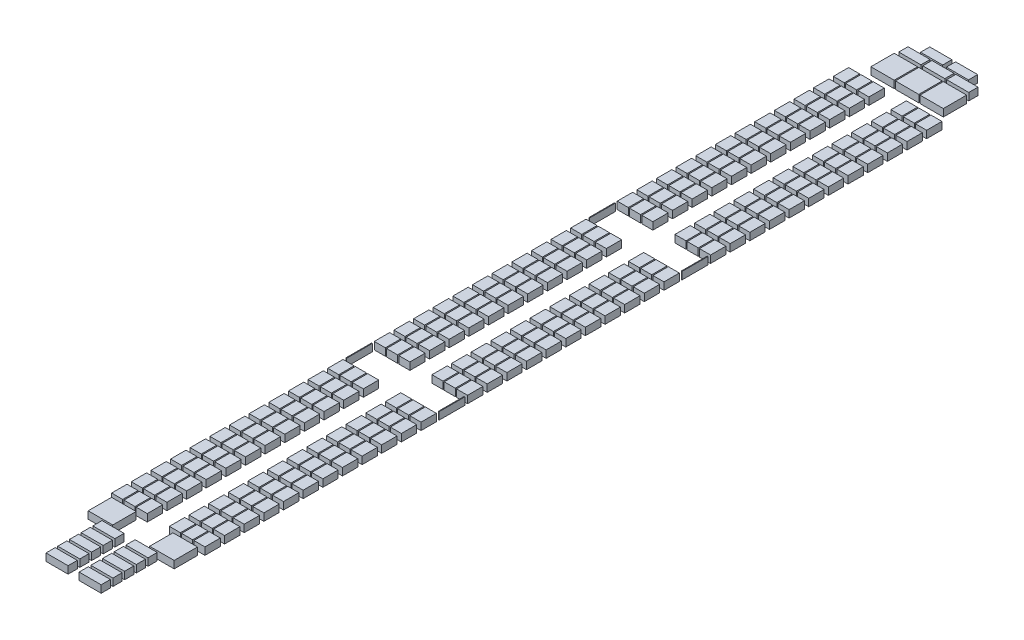
from build123d import *

# Parameters (mm, degrees)
SEATING_LAYOUT_W  = 457.2
SEATING_LAYOUT_H  = 635
SEATINGS_DEPTH    = 304.8
EMERGENCY_DOORS_W = 30.48
EMERGENCY_DOORS_H = 1066.8
EM_DOORS_DEPTH    = 304.8
EM_DOORS_2_DEPTH  = 304.8
EM_DOORS_3_DEPTH  = 304.8
EM_DOORS_4_DEPTH  = 304.8
LAVATORIES_W      = 1016
LAVATORIES_H      = 965.2
LAV_DEPTH         = 304.8
LAV_2_DEPTH       = 304.8
LAVATORIES_W_2    = 965.2
LAV_3_DEPTH       = 304.8
LAV_4_DEPTH       = 304.8
LAV_5_DEPTH       = 304.8
GALLEY_CARTS_W    = 914.4
GALLEY_CARTS_H    = 381
GALLEY_DEPTH      = 304.8
GALLEY_2_DEPTH    = 304.8
GALLEY_3_DEPTH    = 304.8
GALLEY_4_DEPTH    = 304.8
GALLEY_5_DEPTH    = 304.8
GALLEY_6_DEPTH    = 304.8
GALLEY_7_DEPTH    = 304.8
GALLEY_8_DEPTH    = 304.8
GALLEY_9_DEPTH    = 304.8
GALLEY_10_DEPTH   = 304.8
GALLEY_11_DEPTH   = 304.8
GALLEY_12_DEPTH   = 304.8
GALLEY_13_DEPTH   = 304.8
GALLEY_14_DEPTH   = 304.8
GALLEY_15_DEPTH   = 304.8


with BuildPart() as part:
    # Seating layout → Seatings (new body)
    with BuildSketch(Plane(origin=(0, 0, 0), x_dir=(1, 0, 0), z_dir=(0, 1, 0))):
        with Locations((-1193.292, -14930.966666667)):
            Rectangle(SEATING_LAYOUT_W, SEATING_LAYOUT_H)
        with Locations((-1701.292, -14930.966666667)):
            Rectangle(SEATING_LAYOUT_W, SEATING_LAYOUT_H)
        with Locations((-685.292, -14930.966666667)):
            Rectangle(SEATING_LAYOUT_W, SEATING_LAYOUT_H)
        with Locations((-1193.292, -14118.166666667)):
            Rectangle(SEATING_LAYOUT_W, SEATING_LAYOUT_H)
        with Locations((-685.292, -14118.166666667)):
            Rectangle(SEATING_LAYOUT_W, SEATING_LAYOUT_H)
        with Locations((-1193.292, -13305.366666667)):
            Rectangle(SEATING_LAYOUT_W, SEATING_LAYOUT_H)
        with Locations((-685.292, -13305.366666667)):
            Rectangle(SEATING_LAYOUT_W, SEATING_LAYOUT_H)
        with Locations((-1701.292, -14118.166666667)):
            Rectangle(SEATING_LAYOUT_W, SEATING_LAYOUT_H)
        with Locations((-1701.292, -13305.366666667)):
            Rectangle(SEATING_LAYOUT_W, SEATING_LAYOUT_H)
        with Locations((-1701.292, -12492.566666667)):
            Rectangle(SEATING_LAYOUT_W, SEATING_LAYOUT_H)
        with Locations((-1193.292, -12492.566666667)):
            Rectangle(SEATING_LAYOUT_W, SEATING_LAYOUT_H)
        with Locations((-685.292, -12492.566666667)):
            Rectangle(SEATING_LAYOUT_W, SEATING_LAYOUT_H)
        with Locations((-1701.292, -11679.766666667)):
            Rectangle(SEATING_LAYOUT_W, SEATING_LAYOUT_H)
        with Locations((-1193.292, -11679.766666667)):
            Rectangle(SEATING_LAYOUT_W, SEATING_LAYOUT_H)
        with Locations((-685.292, -11679.766666667)):
            Rectangle(SEATING_LAYOUT_W, SEATING_LAYOUT_H)
        with Locations((-1701.292, -10866.966666667)):
            Rectangle(SEATING_LAYOUT_W, SEATING_LAYOUT_H)
        with Locations((-1193.292, -10866.966666667)):
            Rectangle(SEATING_LAYOUT_W, SEATING_LAYOUT_H)
        with Locations((-685.292, -10866.966666667)):
            Rectangle(SEATING_LAYOUT_W, SEATING_LAYOUT_H)
        with Locations((-1701.292, -10054.166666667)):
            Rectangle(SEATING_LAYOUT_W, SEATING_LAYOUT_H)
        with Locations((-1193.292, -10054.166666667)):
            Rectangle(SEATING_LAYOUT_W, SEATING_LAYOUT_H)
        with Locations((-685.292, -10054.166666667)):
            Rectangle(SEATING_LAYOUT_W, SEATING_LAYOUT_H)
        with Locations((-1701.292, -9241.366666667)):
            Rectangle(SEATING_LAYOUT_W, SEATING_LAYOUT_H)
        with Locations((-1193.292, -9241.366666667)):
            Rectangle(SEATING_LAYOUT_W, SEATING_LAYOUT_H)
        with Locations((-685.292, -9241.366666667)):
            Rectangle(SEATING_LAYOUT_W, SEATING_LAYOUT_H)
        with Locations((-1701.292, -8428.566666667)):
            Rectangle(SEATING_LAYOUT_W, SEATING_LAYOUT_H)
        with Locations((-1193.292, -8428.566666667)):
            Rectangle(SEATING_LAYOUT_W, SEATING_LAYOUT_H)
        with Locations((-685.292, -8428.566666667)):
            Rectangle(SEATING_LAYOUT_W, SEATING_LAYOUT_H)
        with Locations((-1701.292, -7615.766666667)):
            Rectangle(SEATING_LAYOUT_W, SEATING_LAYOUT_H)
        with Locations((-1193.292, -7615.766666667)):
            Rectangle(SEATING_LAYOUT_W, SEATING_LAYOUT_H)
        with Locations((-685.292, -7615.766666667)):
            Rectangle(SEATING_LAYOUT_W, SEATING_LAYOUT_H)
        with Locations((-1701.292, -6802.966666667)):
            Rectangle(SEATING_LAYOUT_W, SEATING_LAYOUT_H)
        with Locations((-1193.292, -6802.966666667)):
            Rectangle(SEATING_LAYOUT_W, SEATING_LAYOUT_H)
        with Locations((-685.292, -6802.966666667)):
            Rectangle(SEATING_LAYOUT_W, SEATING_LAYOUT_H)
        with Locations((-1701.292, -5990.166666667)):
            Rectangle(SEATING_LAYOUT_W, SEATING_LAYOUT_H)
        with Locations((-1193.292, -5990.166666667)):
            Rectangle(SEATING_LAYOUT_W, SEATING_LAYOUT_H)
        with Locations((-685.292, -5990.166666667)):
            Rectangle(SEATING_LAYOUT_W, SEATING_LAYOUT_H)
        with Locations((-1701.292, -4064)):
            Rectangle(SEATING_LAYOUT_W, SEATING_LAYOUT_H)
        with Locations((-1193.292, -4064)):
            Rectangle(SEATING_LAYOUT_W, SEATING_LAYOUT_H)
        with Locations((-685.292, -4064)):
            Rectangle(SEATING_LAYOUT_W, SEATING_LAYOUT_H)
        with Locations((-1193.292, -3251.2)):
            Rectangle(SEATING_LAYOUT_W, SEATING_LAYOUT_H)
        with Locations((-685.292, -3251.2)):
            Rectangle(SEATING_LAYOUT_W, SEATING_LAYOUT_H)
        with Locations((-1193.292, -2438.4)):
            Rectangle(SEATING_LAYOUT_W, SEATING_LAYOUT_H)
        with Locations((-685.292, -2438.4)):
            Rectangle(SEATING_LAYOUT_W, SEATING_LAYOUT_H)
        with Locations((-1193.292, -1625.6)):
            Rectangle(SEATING_LAYOUT_W, SEATING_LAYOUT_H)
        with Locations((-685.292, -1625.6)):
            Rectangle(SEATING_LAYOUT_W, SEATING_LAYOUT_H)
        with Locations((-1193.292, -812.8)):
            Rectangle(SEATING_LAYOUT_W, SEATING_LAYOUT_H)
        with Locations((-685.292, -812.8)):
            Rectangle(SEATING_LAYOUT_W, SEATING_LAYOUT_H)
        with Locations((-1701.292, -3251.2)):
            Rectangle(SEATING_LAYOUT_W, SEATING_LAYOUT_H)
        with Locations((-1701.292, -2438.4)):
            Rectangle(SEATING_LAYOUT_W, SEATING_LAYOUT_H)
        with Locations((-1701.292, -1625.6)):
            Rectangle(SEATING_LAYOUT_W, SEATING_LAYOUT_H)
        with Locations((-1701.292, -812.8)):
            Rectangle(SEATING_LAYOUT_W, SEATING_LAYOUT_H)
        with Locations((-1701.292, 0)):
            Rectangle(SEATING_LAYOUT_W, SEATING_LAYOUT_H)
        with Locations((-1193.292, 0)):
            Rectangle(SEATING_LAYOUT_W, SEATING_LAYOUT_H)
        with Locations((-685.292, 0)):
            Rectangle(SEATING_LAYOUT_W, SEATING_LAYOUT_H)
        with Locations((-1701.292, 812.8)):
            Rectangle(SEATING_LAYOUT_W, SEATING_LAYOUT_H)
        with Locations((-1193.292, 812.8)):
            Rectangle(SEATING_LAYOUT_W, SEATING_LAYOUT_H)
        with Locations((-685.292, 812.8)):
            Rectangle(SEATING_LAYOUT_W, SEATING_LAYOUT_H)
        with Locations((-1701.292, 1625.6)):
            Rectangle(SEATING_LAYOUT_W, SEATING_LAYOUT_H)
        with Locations((-1193.292, 1625.6)):
            Rectangle(SEATING_LAYOUT_W, SEATING_LAYOUT_H)
        with Locations((-685.292, 1625.6)):
            Rectangle(SEATING_LAYOUT_W, SEATING_LAYOUT_H)
        with Locations((-1701.292, 2438.4)):
            Rectangle(SEATING_LAYOUT_W, SEATING_LAYOUT_H)
        with Locations((-1193.292, 2438.4)):
            Rectangle(SEATING_LAYOUT_W, SEATING_LAYOUT_H)
        with Locations((-685.292, 2438.4)):
            Rectangle(SEATING_LAYOUT_W, SEATING_LAYOUT_H)
        with Locations((-1701.292, 3251.2)):
            Rectangle(SEATING_LAYOUT_W, SEATING_LAYOUT_H)
        with Locations((-1193.292, 3251.2)):
            Rectangle(SEATING_LAYOUT_W, SEATING_LAYOUT_H)
        with Locations((-685.292, 3251.2)):
            Rectangle(SEATING_LAYOUT_W, SEATING_LAYOUT_H)
        with Locations((-1701.292, 4064)):
            Rectangle(SEATING_LAYOUT_W, SEATING_LAYOUT_H)
        with Locations((-1193.292, 4064)):
            Rectangle(SEATING_LAYOUT_W, SEATING_LAYOUT_H)
        with Locations((-685.292, 4064)):
            Rectangle(SEATING_LAYOUT_W, SEATING_LAYOUT_H)
        with Locations((-685.292, 14930.966666667)):
            Rectangle(SEATING_LAYOUT_W, SEATING_LAYOUT_H)
        with Locations((-1193.292, 14930.966666667)):
            Rectangle(SEATING_LAYOUT_W, SEATING_LAYOUT_H)
        with Locations((-1701.292, 14930.966666667)):
            Rectangle(SEATING_LAYOUT_W, SEATING_LAYOUT_H)
        with Locations((-685.292, 5990.166666667)):
            Rectangle(SEATING_LAYOUT_W, SEATING_LAYOUT_H)
        with Locations((-1193.292, 5990.166666667)):
            Rectangle(SEATING_LAYOUT_W, SEATING_LAYOUT_H)
        with Locations((-1701.292, 5990.166666667)):
            Rectangle(SEATING_LAYOUT_W, SEATING_LAYOUT_H)
        with Locations((-685.292, 6802.966666667)):
            Rectangle(SEATING_LAYOUT_W, SEATING_LAYOUT_H)
        with Locations((-1193.292, 6802.966666667)):
            Rectangle(SEATING_LAYOUT_W, SEATING_LAYOUT_H)
        with Locations((-1701.292, 6802.966666667)):
            Rectangle(SEATING_LAYOUT_W, SEATING_LAYOUT_H)
        with Locations((-685.292, 7615.766666667)):
            Rectangle(SEATING_LAYOUT_W, SEATING_LAYOUT_H)
        with Locations((-1193.292, 7615.766666667)):
            Rectangle(SEATING_LAYOUT_W, SEATING_LAYOUT_H)
        with Locations((-1701.292, 7615.766666667)):
            Rectangle(SEATING_LAYOUT_W, SEATING_LAYOUT_H)
        with Locations((-685.292, 8428.566666667)):
            Rectangle(SEATING_LAYOUT_W, SEATING_LAYOUT_H)
        with Locations((-1193.292, 8428.566666667)):
            Rectangle(SEATING_LAYOUT_W, SEATING_LAYOUT_H)
        with Locations((-1701.292, 8428.566666667)):
            Rectangle(SEATING_LAYOUT_W, SEATING_LAYOUT_H)
        with Locations((-685.292, 9241.366666667)):
            Rectangle(SEATING_LAYOUT_W, SEATING_LAYOUT_H)
        with Locations((-1193.292, 9241.366666667)):
            Rectangle(SEATING_LAYOUT_W, SEATING_LAYOUT_H)
        with Locations((-1701.292, 9241.366666667)):
            Rectangle(SEATING_LAYOUT_W, SEATING_LAYOUT_H)
        with Locations((-685.292, 10054.166666667)):
            Rectangle(SEATING_LAYOUT_W, SEATING_LAYOUT_H)
        with Locations((-1193.292, 10054.166666667)):
            Rectangle(SEATING_LAYOUT_W, SEATING_LAYOUT_H)
        with Locations((-1701.292, 10054.166666667)):
            Rectangle(SEATING_LAYOUT_W, SEATING_LAYOUT_H)
        with Locations((-685.292, 10866.966666667)):
            Rectangle(SEATING_LAYOUT_W, SEATING_LAYOUT_H)
        with Locations((-1193.292, 10866.966666667)):
            Rectangle(SEATING_LAYOUT_W, SEATING_LAYOUT_H)
        with Locations((-1701.292, 10866.966666667)):
            Rectangle(SEATING_LAYOUT_W, SEATING_LAYOUT_H)
        with Locations((-685.292, 11679.766666667)):
            Rectangle(SEATING_LAYOUT_W, SEATING_LAYOUT_H)
        with Locations((-1193.292, 11679.766666667)):
            Rectangle(SEATING_LAYOUT_W, SEATING_LAYOUT_H)
        with Locations((-1701.292, 11679.766666667)):
            Rectangle(SEATING_LAYOUT_W, SEATING_LAYOUT_H)
        with Locations((-685.292, 12492.566666667)):
            Rectangle(SEATING_LAYOUT_W, SEATING_LAYOUT_H)
        with Locations((-1193.292, 12492.566666667)):
            Rectangle(SEATING_LAYOUT_W, SEATING_LAYOUT_H)
        with Locations((-1701.292, 12492.566666667)):
            Rectangle(SEATING_LAYOUT_W, SEATING_LAYOUT_H)
        with Locations((-1701.292, 13305.366666667)):
            Rectangle(SEATING_LAYOUT_W, SEATING_LAYOUT_H)
        with Locations((-1701.292, 14118.166666667)):
            Rectangle(SEATING_LAYOUT_W, SEATING_LAYOUT_H)
        with Locations((-685.292, 13305.366666667)):
            Rectangle(SEATING_LAYOUT_W, SEATING_LAYOUT_H)
        with Locations((-1193.292, 13305.366666667)):
            Rectangle(SEATING_LAYOUT_W, SEATING_LAYOUT_H)
        with Locations((-685.292, 14118.166666667)):
            Rectangle(SEATING_LAYOUT_W, SEATING_LAYOUT_H)
        with Locations((-1193.292, 14118.166666667)):
            Rectangle(SEATING_LAYOUT_W, SEATING_LAYOUT_H)
        with Locations((1193.292, 14930.966666667)):
            Rectangle(SEATING_LAYOUT_W, SEATING_LAYOUT_H)
        with Locations((1701.292, 14930.966666667)):
            Rectangle(SEATING_LAYOUT_W, SEATING_LAYOUT_H)
        with Locations((685.292, 14930.966666667)):
            Rectangle(SEATING_LAYOUT_W, SEATING_LAYOUT_H)
        with Locations((1193.292, 14118.166666667)):
            Rectangle(SEATING_LAYOUT_W, SEATING_LAYOUT_H)
        with Locations((685.292, 14118.166666667)):
            Rectangle(SEATING_LAYOUT_W, SEATING_LAYOUT_H)
        with Locations((1193.292, 13305.366666667)):
            Rectangle(SEATING_LAYOUT_W, SEATING_LAYOUT_H)
        with Locations((685.292, 13305.366666667)):
            Rectangle(SEATING_LAYOUT_W, SEATING_LAYOUT_H)
        with Locations((1701.292, 14118.166666667)):
            Rectangle(SEATING_LAYOUT_W, SEATING_LAYOUT_H)
        with Locations((1701.292, 13305.366666667)):
            Rectangle(SEATING_LAYOUT_W, SEATING_LAYOUT_H)
        with Locations((1701.292, 12492.566666667)):
            Rectangle(SEATING_LAYOUT_W, SEATING_LAYOUT_H)
        with Locations((1193.292, 12492.566666667)):
            Rectangle(SEATING_LAYOUT_W, SEATING_LAYOUT_H)
        with Locations((685.292, 12492.566666667)):
            Rectangle(SEATING_LAYOUT_W, SEATING_LAYOUT_H)
        with Locations((1701.292, 11679.766666667)):
            Rectangle(SEATING_LAYOUT_W, SEATING_LAYOUT_H)
        with Locations((1193.292, 11679.766666667)):
            Rectangle(SEATING_LAYOUT_W, SEATING_LAYOUT_H)
        with Locations((685.292, 11679.766666667)):
            Rectangle(SEATING_LAYOUT_W, SEATING_LAYOUT_H)
        with Locations((1701.292, 10866.966666667)):
            Rectangle(SEATING_LAYOUT_W, SEATING_LAYOUT_H)
        with Locations((1193.292, 10866.966666667)):
            Rectangle(SEATING_LAYOUT_W, SEATING_LAYOUT_H)
        with Locations((685.292, 10866.966666667)):
            Rectangle(SEATING_LAYOUT_W, SEATING_LAYOUT_H)
        with Locations((1701.292, 10054.166666667)):
            Rectangle(SEATING_LAYOUT_W, SEATING_LAYOUT_H)
        with Locations((1193.292, 10054.166666667)):
            Rectangle(SEATING_LAYOUT_W, SEATING_LAYOUT_H)
        with Locations((685.292, 10054.166666667)):
            Rectangle(SEATING_LAYOUT_W, SEATING_LAYOUT_H)
        with Locations((1701.292, 9241.366666667)):
            Rectangle(SEATING_LAYOUT_W, SEATING_LAYOUT_H)
        with Locations((1193.292, 9241.366666667)):
            Rectangle(SEATING_LAYOUT_W, SEATING_LAYOUT_H)
        with Locations((685.292, 9241.366666667)):
            Rectangle(SEATING_LAYOUT_W, SEATING_LAYOUT_H)
        with Locations((1701.292, 8428.566666667)):
            Rectangle(SEATING_LAYOUT_W, SEATING_LAYOUT_H)
        with Locations((1193.292, 8428.566666667)):
            Rectangle(SEATING_LAYOUT_W, SEATING_LAYOUT_H)
        with Locations((685.292, 8428.566666667)):
            Rectangle(SEATING_LAYOUT_W, SEATING_LAYOUT_H)
        with Locations((1701.292, 7615.766666667)):
            Rectangle(SEATING_LAYOUT_W, SEATING_LAYOUT_H)
        with Locations((1193.292, 7615.766666667)):
            Rectangle(SEATING_LAYOUT_W, SEATING_LAYOUT_H)
        with Locations((685.292, 7615.766666667)):
            Rectangle(SEATING_LAYOUT_W, SEATING_LAYOUT_H)
        with Locations((1701.292, 6802.966666667)):
            Rectangle(SEATING_LAYOUT_W, SEATING_LAYOUT_H)
        with Locations((1193.292, 6802.966666667)):
            Rectangle(SEATING_LAYOUT_W, SEATING_LAYOUT_H)
        with Locations((685.292, 6802.966666667)):
            Rectangle(SEATING_LAYOUT_W, SEATING_LAYOUT_H)
        with Locations((1701.292, 5990.166666667)):
            Rectangle(SEATING_LAYOUT_W, SEATING_LAYOUT_H)
        with Locations((1193.292, 5990.166666667)):
            Rectangle(SEATING_LAYOUT_W, SEATING_LAYOUT_H)
        with Locations((685.292, 5990.166666667)):
            Rectangle(SEATING_LAYOUT_W, SEATING_LAYOUT_H)
        with Locations((685.292, 4064)):
            Rectangle(SEATING_LAYOUT_W, SEATING_LAYOUT_H)
        with Locations((1193.292, 4064)):
            Rectangle(SEATING_LAYOUT_W, SEATING_LAYOUT_H)
        with Locations((1701.292, 4064)):
            Rectangle(SEATING_LAYOUT_W, SEATING_LAYOUT_H)
        with Locations((685.292, 3251.2)):
            Rectangle(SEATING_LAYOUT_W, SEATING_LAYOUT_H)
        with Locations((1193.292, 3251.2)):
            Rectangle(SEATING_LAYOUT_W, SEATING_LAYOUT_H)
        with Locations((1701.292, 3251.2)):
            Rectangle(SEATING_LAYOUT_W, SEATING_LAYOUT_H)
        with Locations((685.292, 2438.4)):
            Rectangle(SEATING_LAYOUT_W, SEATING_LAYOUT_H)
        with Locations((1193.292, 2438.4)):
            Rectangle(SEATING_LAYOUT_W, SEATING_LAYOUT_H)
        with Locations((1701.292, 2438.4)):
            Rectangle(SEATING_LAYOUT_W, SEATING_LAYOUT_H)
        with Locations((685.292, 1625.6)):
            Rectangle(SEATING_LAYOUT_W, SEATING_LAYOUT_H)
        with Locations((1193.292, 1625.6)):
            Rectangle(SEATING_LAYOUT_W, SEATING_LAYOUT_H)
        with Locations((1701.292, 1625.6)):
            Rectangle(SEATING_LAYOUT_W, SEATING_LAYOUT_H)
        with Locations((685.292, 812.8)):
            Rectangle(SEATING_LAYOUT_W, SEATING_LAYOUT_H)
        with Locations((1193.292, 812.8)):
            Rectangle(SEATING_LAYOUT_W, SEATING_LAYOUT_H)
        with Locations((1701.292, 812.8)):
            Rectangle(SEATING_LAYOUT_W, SEATING_LAYOUT_H)
        with Locations((685.292, 0)):
            Rectangle(SEATING_LAYOUT_W, SEATING_LAYOUT_H)
        with Locations((1193.292, 0)):
            Rectangle(SEATING_LAYOUT_W, SEATING_LAYOUT_H)
        with Locations((1701.292, 0)):
            Rectangle(SEATING_LAYOUT_W, SEATING_LAYOUT_H)
        with Locations((1701.292, -812.8)):
            Rectangle(SEATING_LAYOUT_W, SEATING_LAYOUT_H)
        with Locations((1701.292, -1625.6)):
            Rectangle(SEATING_LAYOUT_W, SEATING_LAYOUT_H)
        with Locations((1701.292, -2438.4)):
            Rectangle(SEATING_LAYOUT_W, SEATING_LAYOUT_H)
        with Locations((1701.292, -3251.2)):
            Rectangle(SEATING_LAYOUT_W, SEATING_LAYOUT_H)
        with Locations((685.292, -812.8)):
            Rectangle(SEATING_LAYOUT_W, SEATING_LAYOUT_H)
        with Locations((1193.292, -812.8)):
            Rectangle(SEATING_LAYOUT_W, SEATING_LAYOUT_H)
        with Locations((685.292, -1625.6)):
            Rectangle(SEATING_LAYOUT_W, SEATING_LAYOUT_H)
        with Locations((1193.292, -1625.6)):
            Rectangle(SEATING_LAYOUT_W, SEATING_LAYOUT_H)
        with Locations((685.292, -2438.4)):
            Rectangle(SEATING_LAYOUT_W, SEATING_LAYOUT_H)
        with Locations((1193.292, -2438.4)):
            Rectangle(SEATING_LAYOUT_W, SEATING_LAYOUT_H)
        with Locations((685.292, -3251.2)):
            Rectangle(SEATING_LAYOUT_W, SEATING_LAYOUT_H)
        with Locations((1193.292, -3251.2)):
            Rectangle(SEATING_LAYOUT_W, SEATING_LAYOUT_H)
        with Locations((685.292, -4064)):
            Rectangle(SEATING_LAYOUT_W, SEATING_LAYOUT_H)
        with Locations((1193.292, -4064)):
            Rectangle(SEATING_LAYOUT_W, SEATING_LAYOUT_H)
        with Locations((1701.292, -4064)):
            Rectangle(SEATING_LAYOUT_W, SEATING_LAYOUT_H)
        with Locations((685.292, -5990.166666667)):
            Rectangle(SEATING_LAYOUT_W, SEATING_LAYOUT_H)
        with Locations((1193.292, -5990.166666667)):
            Rectangle(SEATING_LAYOUT_W, SEATING_LAYOUT_H)
        with Locations((1701.292, -5990.166666667)):
            Rectangle(SEATING_LAYOUT_W, SEATING_LAYOUT_H)
        with Locations((685.292, -6802.966666667)):
            Rectangle(SEATING_LAYOUT_W, SEATING_LAYOUT_H)
        with Locations((1193.292, -6802.966666667)):
            Rectangle(SEATING_LAYOUT_W, SEATING_LAYOUT_H)
        with Locations((1701.292, -6802.966666667)):
            Rectangle(SEATING_LAYOUT_W, SEATING_LAYOUT_H)
        with Locations((685.292, -7615.766666667)):
            Rectangle(SEATING_LAYOUT_W, SEATING_LAYOUT_H)
        with Locations((1193.292, -7615.766666667)):
            Rectangle(SEATING_LAYOUT_W, SEATING_LAYOUT_H)
        with Locations((1701.292, -7615.766666667)):
            Rectangle(SEATING_LAYOUT_W, SEATING_LAYOUT_H)
        with Locations((685.292, -8428.566666667)):
            Rectangle(SEATING_LAYOUT_W, SEATING_LAYOUT_H)
        with Locations((1193.292, -8428.566666667)):
            Rectangle(SEATING_LAYOUT_W, SEATING_LAYOUT_H)
        with Locations((1701.292, -8428.566666667)):
            Rectangle(SEATING_LAYOUT_W, SEATING_LAYOUT_H)
        with Locations((685.292, -9241.366666667)):
            Rectangle(SEATING_LAYOUT_W, SEATING_LAYOUT_H)
        with Locations((1193.292, -9241.366666667)):
            Rectangle(SEATING_LAYOUT_W, SEATING_LAYOUT_H)
        with Locations((1701.292, -9241.366666667)):
            Rectangle(SEATING_LAYOUT_W, SEATING_LAYOUT_H)
        with Locations((685.292, -10054.166666667)):
            Rectangle(SEATING_LAYOUT_W, SEATING_LAYOUT_H)
        with Locations((1193.292, -10054.166666667)):
            Rectangle(SEATING_LAYOUT_W, SEATING_LAYOUT_H)
        with Locations((1701.292, -10054.166666667)):
            Rectangle(SEATING_LAYOUT_W, SEATING_LAYOUT_H)
        with Locations((685.292, -10866.966666667)):
            Rectangle(SEATING_LAYOUT_W, SEATING_LAYOUT_H)
        with Locations((1193.292, -10866.966666667)):
            Rectangle(SEATING_LAYOUT_W, SEATING_LAYOUT_H)
        with Locations((1701.292, -10866.966666667)):
            Rectangle(SEATING_LAYOUT_W, SEATING_LAYOUT_H)
        with Locations((685.292, -11679.766666667)):
            Rectangle(SEATING_LAYOUT_W, SEATING_LAYOUT_H)
        with Locations((1193.292, -11679.766666667)):
            Rectangle(SEATING_LAYOUT_W, SEATING_LAYOUT_H)
        with Locations((1701.292, -11679.766666667)):
            Rectangle(SEATING_LAYOUT_W, SEATING_LAYOUT_H)
        with Locations((685.292, -12492.566666667)):
            Rectangle(SEATING_LAYOUT_W, SEATING_LAYOUT_H)
        with Locations((1193.292, -12492.566666667)):
            Rectangle(SEATING_LAYOUT_W, SEATING_LAYOUT_H)
        with Locations((1701.292, -12492.566666667)):
            Rectangle(SEATING_LAYOUT_W, SEATING_LAYOUT_H)
        with Locations((1701.292, -13305.366666667)):
            Rectangle(SEATING_LAYOUT_W, SEATING_LAYOUT_H)
        with Locations((1701.292, -14118.166666667)):
            Rectangle(SEATING_LAYOUT_W, SEATING_LAYOUT_H)
        with Locations((685.292, -13305.366666667)):
            Rectangle(SEATING_LAYOUT_W, SEATING_LAYOUT_H)
        with Locations((1193.292, -13305.366666667)):
            Rectangle(SEATING_LAYOUT_W, SEATING_LAYOUT_H)
        with Locations((685.292, -14118.166666667)):
            Rectangle(SEATING_LAYOUT_W, SEATING_LAYOUT_H)
        with Locations((1193.292, -14118.166666667)):
            Rectangle(SEATING_LAYOUT_W, SEATING_LAYOUT_H)
        with Locations((685.292, -14930.966666667)):
            Rectangle(SEATING_LAYOUT_W, SEATING_LAYOUT_H)
        with Locations((1193.292, -14930.966666667)):
            Rectangle(SEATING_LAYOUT_W, SEATING_LAYOUT_H)
        with Locations((1701.292, -14930.966666667)):
            Rectangle(SEATING_LAYOUT_W, SEATING_LAYOUT_H)
    extrude(amount=SEATINGS_DEPTH)


with BuildPart() as body_2:
    # Emergency Doors → EM Doors (new body)
    with BuildSketch(Plane(origin=(0, 0, 0), x_dir=(1, 0, 0), z_dir=(0, 1, 0))):
        with Locations((-1914.652, 5027.083333333)):
            Rectangle(EMERGENCY_DOORS_W, EMERGENCY_DOORS_H)
    extrude(amount=EM_DOORS_DEPTH)


with BuildPart() as body_3:
    # Emergency Doors → EM Doors 2 (new body)
    with BuildSketch(Plane(origin=(0, 0, 0), x_dir=(1, 0, 0), z_dir=(0, 1, 0))):
        with Locations((1914.652, 5027.083333333)):
            Rectangle(EMERGENCY_DOORS_W, EMERGENCY_DOORS_H)
    extrude(amount=EM_DOORS_2_DEPTH)


with BuildPart() as body_4:
    # Emergency Doors → EM Doors 3 (new body)
    with BuildSketch(Plane(origin=(0, 0, 0), x_dir=(1, 0, 0), z_dir=(0, 1, 0))):
        with Locations((1914.652, -5027.083333333)):
            Rectangle(EMERGENCY_DOORS_W, EMERGENCY_DOORS_H)
    extrude(amount=EM_DOORS_3_DEPTH)


with BuildPart() as body_5:
    # Emergency Doors → EM Doors 4 (new body)
    with BuildSketch(Plane(origin=(0, 0, 0), x_dir=(1, 0, 0), z_dir=(0, 1, 0))):
        with Locations((-1914.652, -5027.083333333)):
            Rectangle(EMERGENCY_DOORS_W, EMERGENCY_DOORS_H)
    extrude(amount=EM_DOORS_4_DEPTH)


with BuildPart() as body_6:
    # Lavatories → LAV (new body)
    with BuildSketch(Plane(origin=(0, 0, 0), x_dir=(1, 0, 0), z_dir=(0, 1, 0))):
        with Locations((-1270.93486918, -15887.833325272)):
            Rectangle(LAVATORIES_W, LAVATORIES_H)
    extrude(amount=LAV_DEPTH)


with BuildPart() as body_7:
    # Lavatories → LAV 2 (new body)
    with BuildSketch(Plane(origin=(0, 0, 0), x_dir=(1, 0, 0), z_dir=(0, 1, 0))):
        with Locations((1270.93486918, -15887.833325272)):
            Rectangle(LAVATORIES_W, LAVATORIES_H)
    extrude(amount=LAV_2_DEPTH)


with BuildPart() as body_8:
    # Lavatories → LAV 3 (new body)
    with BuildSketch(Plane(origin=(0, 0, 0), x_dir=(1, 0, 0), z_dir=(0, 1, 0))):
        with Locations((0, 16219.247411075)):
            Rectangle(LAVATORIES_W_2, LAVATORIES_H)
    extrude(amount=LAV_3_DEPTH)


with BuildPart() as body_9:
    # Lavatories → LAV 4 (new body)
    with BuildSketch(Plane(origin=(0, 0, 0), x_dir=(1, 0, 0), z_dir=(0, 1, 0))):
        with Locations((-1016, 16219.247411075)):
            Rectangle(LAVATORIES_W_2, LAVATORIES_H)
    extrude(amount=LAV_4_DEPTH)


with BuildPart() as body_10:
    # Lavatories → LAV 5 (new body)
    with BuildSketch(Plane(origin=(0, 0, 0), x_dir=(1, 0, 0), z_dir=(0, 1, 0))):
        with Locations((1016, 16219.247411075)):
            Rectangle(LAVATORIES_W_2, LAVATORIES_H)
    extrude(amount=LAV_5_DEPTH)


with BuildPart() as body_11:
    # galley carts → Galley (new body)
    with BuildSketch(Plane(origin=(0, 0, 0), x_dir=(1, 0, 0), z_dir=(0, 1, 0))):
        with Locations((-684.604235921, -17110.363360042)):
            Rectangle(GALLEY_CARTS_W, GALLEY_CARTS_H)
    extrude(amount=GALLEY_DEPTH)


with BuildPart() as body_12:
    # galley carts → Galley 2 (new body)
    with BuildSketch(Plane(origin=(0, 0, 0), x_dir=(1, 0, 0), z_dir=(0, 1, 0))):
        with Locations((-684.604235921, -16626.124863435)):
            Rectangle(GALLEY_CARTS_W, GALLEY_CARTS_H)
    extrude(amount=GALLEY_2_DEPTH)


with BuildPart() as body_13:
    # galley carts → Galley 3 (new body)
    with BuildSketch(Plane(origin=(0, 0, 0), x_dir=(1, 0, 0), z_dir=(0, 1, 0))):
        with Locations((-684.604235921, -17594.601856648)):
            Rectangle(GALLEY_CARTS_W, GALLEY_CARTS_H)
    extrude(amount=GALLEY_3_DEPTH)


with BuildPart() as body_14:
    # galley carts → Galley 4 (new body)
    with BuildSketch(Plane(origin=(0, 0, 0), x_dir=(1, 0, 0), z_dir=(0, 1, 0))):
        with Locations((-684.604235921, -18078.840353255)):
            Rectangle(GALLEY_CARTS_W, GALLEY_CARTS_H)
    extrude(amount=GALLEY_4_DEPTH)


with BuildPart() as body_15:
    # galley carts → Galley 5 (new body)
    with BuildSketch(Plane(origin=(0, 0, 0), x_dir=(1, 0, 0), z_dir=(0, 1, 0))):
        with Locations((-684.604235921, -18563.078849861)):
            Rectangle(GALLEY_CARTS_W, GALLEY_CARTS_H)
    extrude(amount=GALLEY_5_DEPTH)


with BuildPart() as body_16:
    # galley carts → Galley 6 (new body)
    with BuildSketch(Plane(origin=(0, 0, 0), x_dir=(1, 0, 0), z_dir=(0, 1, 0))):
        with Locations((684.604235921, -18563.078849861)):
            Rectangle(GALLEY_CARTS_W, GALLEY_CARTS_H)
    extrude(amount=GALLEY_6_DEPTH)


with BuildPart() as body_17:
    # galley carts → Galley 7 (new body)
    with BuildSketch(Plane(origin=(0, 0, 0), x_dir=(1, 0, 0), z_dir=(0, 1, 0))):
        with Locations((684.604235921, -18078.840353255)):
            Rectangle(GALLEY_CARTS_W, GALLEY_CARTS_H)
    extrude(amount=GALLEY_7_DEPTH)


with BuildPart() as body_18:
    # galley carts → Galley 8 (new body)
    with BuildSketch(Plane(origin=(0, 0, 0), x_dir=(1, 0, 0), z_dir=(0, 1, 0))):
        with Locations((684.604235921, -17594.601856648)):
            Rectangle(GALLEY_CARTS_W, GALLEY_CARTS_H)
    extrude(amount=GALLEY_8_DEPTH)


with BuildPart() as body_19:
    # galley carts → Galley 9 (new body)
    with BuildSketch(Plane(origin=(0, 0, 0), x_dir=(1, 0, 0), z_dir=(0, 1, 0))):
        with Locations((684.604235921, -17110.363360042)):
            Rectangle(GALLEY_CARTS_W, GALLEY_CARTS_H)
    extrude(amount=GALLEY_9_DEPTH)


with BuildPart() as body_20:
    # galley carts → Galley 10 (new body)
    with BuildSketch(Plane(origin=(0, 0, 0), x_dir=(1, 0, 0), z_dir=(0, 1, 0))):
        with Locations((684.604235921, -16626.124863435)):
            Rectangle(GALLEY_CARTS_W, GALLEY_CARTS_H)
    extrude(amount=GALLEY_10_DEPTH)


with BuildPart() as body_21:
    # galley carts → Galley 11 (new body)
    with BuildSketch(Plane(origin=(0, 0, 0), x_dir=(1, 0, 0), z_dir=(0, 1, 0))):
        with Locations((0, 17031.641528704)):
            Rectangle(GALLEY_CARTS_W, GALLEY_CARTS_H)
    extrude(amount=GALLEY_11_DEPTH)


with BuildPart() as body_22:
    # galley carts → Galley 12 (new body)
    with BuildSketch(Plane(origin=(0, 0, 0), x_dir=(1, 0, 0), z_dir=(0, 1, 0))):
        with Locations((-991.393699307, 17031.641528704)):
            Rectangle(GALLEY_CARTS_W, GALLEY_CARTS_H)
    extrude(amount=GALLEY_12_DEPTH)


with BuildPart() as body_23:
    # galley carts → Galley 13 (new body)
    with BuildSketch(Plane(origin=(0, 0, 0), x_dir=(1, 0, 0), z_dir=(0, 1, 0))):
        with Locations((991.393699307, 17031.641528704)):
            Rectangle(GALLEY_CARTS_W, GALLEY_CARTS_H)
    extrude(amount=GALLEY_13_DEPTH)


with BuildPart() as body_24:
    # galley carts → Galley 14 (new body)
    with BuildSketch(Plane(origin=(0, 0, 0), x_dir=(1, 0, 0), z_dir=(0, 1, 0))):
        with Locations((534.193699307, 17475.007744754)):
            Rectangle(GALLEY_CARTS_W, GALLEY_CARTS_H)
    extrude(amount=GALLEY_14_DEPTH)


with BuildPart() as body_25:
    # galley carts → Galley 15 (new body)
    with BuildSketch(Plane(origin=(0, 0, 0), x_dir=(1, 0, 0), z_dir=(0, 1, 0))):
        with Locations((-534.193699307, 17475.007744754)):
            Rectangle(GALLEY_CARTS_W, GALLEY_CARTS_H)
    extrude(amount=GALLEY_15_DEPTH)


solid = Compound([part.part, body_2.part, body_3.part, body_4.part, body_5.part, body_6.part, body_7.part, body_8.part, body_9.part, body_10.part, body_11.part, body_12.part, body_13.part, body_14.part, body_15.part, body_16.part, body_17.part, body_18.part, body_19.part, body_20.part, body_21.part, body_22.part, body_23.part, body_24.part, body_25.part])
